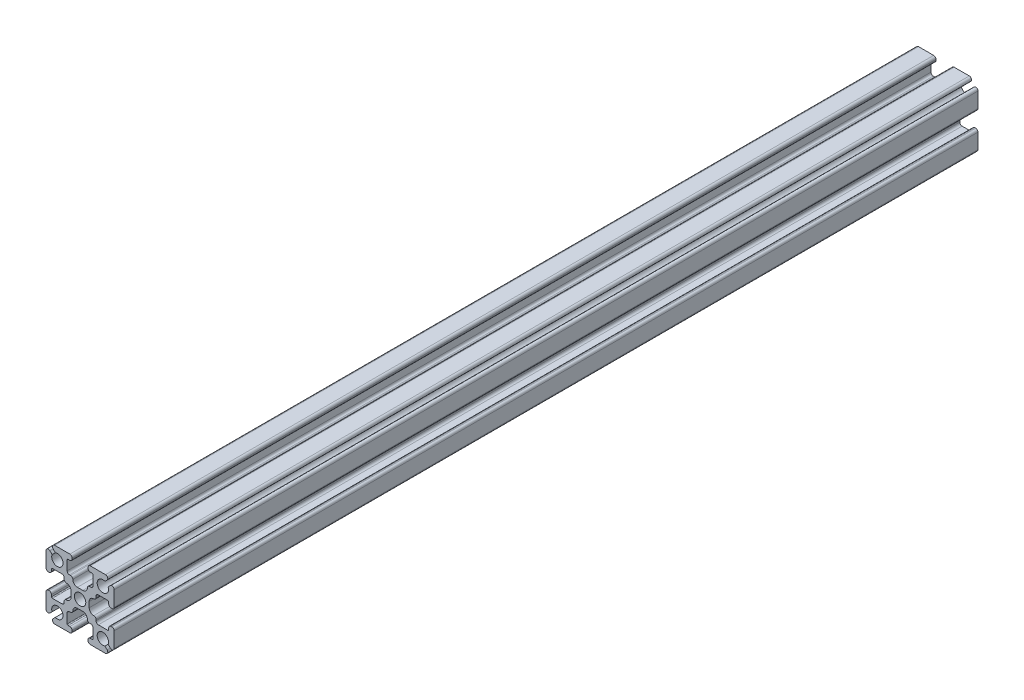
from build123d import *

# Parameters (mm, degrees)
SKETCH1_R           = 1.25
BOSS_EXTRUDE1_DEPTH = 190


with BuildPart() as part:
    # Sketch1 → Boss-Extrude1 (new body)
    with BuildSketch(Plane.XY):
        with BuildLine():
            Line((6.646446609, 5.939339828), (6.163645978, 5.456539197))
            ThreePointArc((6.163645978, 5.456539197), (4.116116524, 4.116116524), (5.456539197, 6.163645978))
            Line((5.456539197, 6.163645978), (5.939339828, 6.646446609))
            ThreePointArc((5.939339828, 6.646446609), (6.047726204, 7.191341716), (5.585786438, 7.5))
            Line((5.585786438, 7.5), (2.25, 7.5))
            ThreePointArc((2.25, 7.5), (1.896446609, 7.353553391), (1.75, 7))
            Line((1.75, 7), (1.75, 6.8))
            ThreePointArc((1.75, 6.8), (1.896446609, 6.446446609), (2.25, 6.3))
            Line((2.25, 6.3), (2.65, 6.3))
            ThreePointArc((2.65, 6.3), (2.791421356, 6.241421356), (2.85, 6.1))
            Line((2.85, 6.1), (2.85, 4))
            ThreePointArc((2.85, 4), (2.703553391, 3.646446609), (2.35, 3.5))
            Line((2.35, 3.5), (2.1, 3.5))
            ThreePointArc((2.1, 3.5), (1.746446609, 3.353553391), (1.6, 3))
            ThreePointArc((1.6, 3), (1.307106781, 2.292893219), (0.6, 2))
            Line((0.6, 2), (-0.6, 2))
            ThreePointArc((-0.6, 2), (-1.307106781, 2.292893219), (-1.6, 3))
            ThreePointArc((-1.6, 3), (-1.746446609, 3.353553391), (-2.1, 3.5))
            Line((-2.1, 3.5), (-2.35, 3.5))
            ThreePointArc((-2.35, 3.5), (-2.703553391, 3.646446609), (-2.85, 4))
            Line((-2.85, 4), (-2.85, 6.1))
            ThreePointArc((-2.85, 6.1), (-2.791421356, 6.241421356), (-2.65, 6.3))
            Line((-2.65, 6.3), (-2.25, 6.3))
            ThreePointArc((-2.25, 6.3), (-1.896446609, 6.446446609), (-1.75, 6.8))
            Line((-1.75, 6.8), (-1.75, 7))
            ThreePointArc((-1.75, 7), (-1.896446609, 7.353553391), (-2.25, 7.5))
            Line((-2.25, 7.5), (-5.585786438, 7.5))
            ThreePointArc((-5.585786438, 7.5), (-6.047726204, 7.191341716), (-5.939339828, 6.646446609))
            Line((-5.939339828, 6.646446609), (-5.456539197, 6.163645978))
            ThreePointArc((-5.456539197, 6.163645978), (-4.116116524, 4.116116524), (-6.163645978, 5.456539197))
            Line((-6.163645978, 5.456539197), (-6.646446609, 5.939339828))
            ThreePointArc((-6.646446609, 5.939339828), (-7.191341716, 6.047726204), (-7.5, 5.585786438))
            Line((-7.5, 5.585786438), (-7.5, 2.25))
            ThreePointArc((-7.5, 2.25), (-7.353553391, 1.896446609), (-7, 1.75))
            Line((-7, 1.75), (-6.8, 1.75))
            ThreePointArc((-6.8, 1.75), (-6.446446609, 1.896446609), (-6.3, 2.25))
            Line((-6.3, 2.25), (-6.3, 2.65))
            ThreePointArc((-6.3, 2.65), (-6.241421356, 2.791421356), (-6.1, 2.85))
            Line((-6.1, 2.85), (-4, 2.85))
            ThreePointArc((-4, 2.85), (-3.646446609, 2.703553391), (-3.5, 2.35))
            Line((-3.5, 2.35), (-3.5, 2.1))
            ThreePointArc((-3.5, 2.1), (-3.353553391, 1.746446609), (-3, 1.6))
            ThreePointArc((-3, 1.6), (-2.292893219, 1.307106781), (-2, 0.6))
            Line((-2, 0.6), (-2, -0.6))
            ThreePointArc((-2, -0.6), (-2.292893219, -1.307106781), (-3, -1.6))
            ThreePointArc((-3, -1.6), (-3.353553391, -1.746446609), (-3.5, -2.1))
            Line((-3.5, -2.1), (-3.5, -2.35))
            ThreePointArc((-3.5, -2.35), (-3.646446609, -2.703553391), (-4, -2.85))
            Line((-4, -2.85), (-6.1, -2.85))
            ThreePointArc((-6.1, -2.85), (-6.241421356, -2.791421356), (-6.3, -2.65))
            Line((-6.3, -2.65), (-6.3, -2.25))
            ThreePointArc((-6.3, -2.25), (-6.446446609, -1.896446609), (-6.8, -1.75))
            Line((-6.8, -1.75), (-7, -1.75))
            ThreePointArc((-7, -1.75), (-7.353553391, -1.896446609), (-7.5, -2.25))
            Line((-7.5, -2.25), (-7.5, -5.585786438))
            ThreePointArc((-7.5, -5.585786438), (-7.191341716, -6.047726204), (-6.646446609, -5.939339828))
            Line((-6.646446609, -5.939339828), (-6.163645978, -5.456539197))
            ThreePointArc((-6.163645978, -5.456539197), (-4.116116524, -4.116116524), (-5.456539197, -6.163645978))
            Line((-5.456539197, -6.163645978), (-5.939339828, -6.646446609))
            ThreePointArc((-5.939339828, -6.646446609), (-6.047726204, -7.191341716), (-5.585786438, -7.5))
            Line((-5.585786438, -7.5), (-2.25, -7.5))
            ThreePointArc((-2.25, -7.5), (-1.896446609, -7.353553391), (-1.75, -7))
            Line((-1.75, -7), (-1.75, -6.8))
            ThreePointArc((-1.75, -6.8), (-1.896446609, -6.446446609), (-2.25, -6.3))
            Line((-2.25, -6.3), (-2.65, -6.3))
            ThreePointArc((-2.65, -6.3), (-2.791421356, -6.241421356), (-2.85, -6.1))
            Line((-2.85, -6.1), (-2.85, -4))
            ThreePointArc((-2.85, -4), (-2.703553391, -3.646446609), (-2.35, -3.5))
            Line((-2.35, -3.5), (-2.1, -3.5))
            ThreePointArc((-2.1, -3.5), (-1.746446609, -3.353553391), (-1.6, -3))
            ThreePointArc((-1.6, -3), (-1.307106781, -2.292893219), (-0.6, -2))
            Line((-0.6, -2), (0.6, -2))
            ThreePointArc((0.6, -2), (1.307106781, -2.292893219), (1.6, -3))
            ThreePointArc((1.6, -3), (1.746446609, -3.353553391), (2.1, -3.5))
            Line((2.1, -3.5), (2.35, -3.5))
            ThreePointArc((2.35, -3.5), (2.703553391, -3.646446609), (2.85, -4))
            Line((2.85, -4), (2.85, -6.1))
            ThreePointArc((2.85, -6.1), (2.791421356, -6.241421356), (2.65, -6.3))
            Line((2.65, -6.3), (2.25, -6.3))
            ThreePointArc((2.25, -6.3), (1.896446609, -6.446446609), (1.75, -6.8))
            Line((1.75, -6.8), (1.75, -7))
            ThreePointArc((1.75, -7), (1.896446609, -7.353553391), (2.25, -7.5))
            Line((2.25, -7.5), (5.585786438, -7.5))
            ThreePointArc((5.585786438, -7.5), (6.047726204, -7.191341716), (5.939339828, -6.646446609))
            Line((5.939339828, -6.646446609), (5.456539197, -6.163645978))
            ThreePointArc((5.456539197, -6.163645978), (4.116116524, -4.116116524), (6.163645978, -5.456539197))
            Line((6.163645978, -5.456539197), (6.646446609, -5.939339828))
            ThreePointArc((6.646446609, -5.939339828), (7.191341716, -6.047726204), (7.5, -5.585786438))
            Line((7.5, -5.585786438), (7.5, -2.25))
            ThreePointArc((7.5, -2.25), (7.353553391, -1.896446609), (7, -1.75))
            Line((7, -1.75), (6.8, -1.75))
            ThreePointArc((6.8, -1.75), (6.446446609, -1.896446609), (6.3, -2.25))
            Line((6.3, -2.25), (6.3, -2.65))
            ThreePointArc((6.3, -2.65), (6.241421356, -2.791421356), (6.1, -2.85))
            Line((6.1, -2.85), (4, -2.85))
            ThreePointArc((4, -2.85), (3.646446609, -2.703553391), (3.5, -2.35))
            Line((3.5, -2.35), (3.5, -2.1))
            ThreePointArc((3.5, -2.1), (3.353553391, -1.746446609), (3, -1.6))
            ThreePointArc((3, -1.6), (2.292893219, -1.307106781), (2, -0.6))
            Line((2, -0.6), (2, 0.6))
            ThreePointArc((2, 0.6), (2.292893219, 1.307106781), (3, 1.6))
            ThreePointArc((3, 1.6), (3.353553391, 1.746446609), (3.5, 2.1))
            Line((3.5, 2.1), (3.5, 2.35))
            ThreePointArc((3.5, 2.35), (3.646446609, 2.703553391), (4, 2.85))
            Line((4, 2.85), (6.1, 2.85))
            ThreePointArc((6.1, 2.85), (6.241421356, 2.791421356), (6.3, 2.65))
            Line((6.3, 2.65), (6.3, 2.25))
            ThreePointArc((6.3, 2.25), (6.446446609, 1.896446609), (6.8, 1.75))
            Line((6.8, 1.75), (7, 1.75))
            ThreePointArc((7, 1.75), (7.353553391, 1.896446609), (7.5, 2.25))
            Line((7.5, 2.25), (7.5, 5.585786438))
            ThreePointArc((7.5, 5.585786438), (7.191341716, 6.047726204), (6.646446609, 5.939339828))
        make_face()
        Circle(SKETCH1_R, mode=Mode.SUBTRACT)
    extrude(amount=BOSS_EXTRUDE1_DEPTH)


solid = part.part
